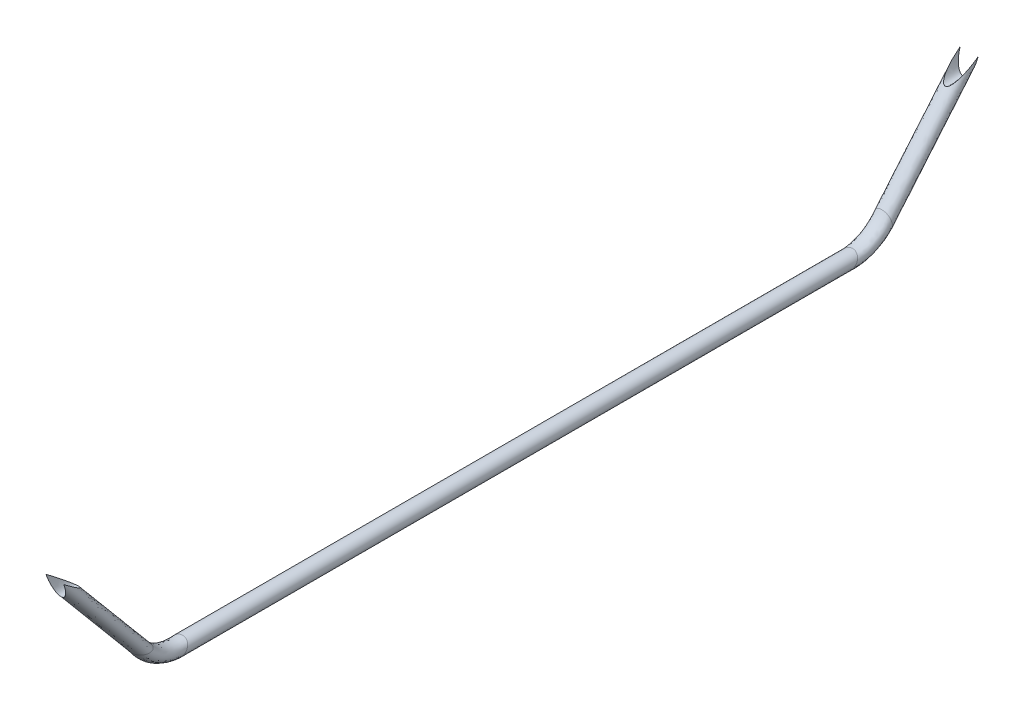
from build123d import *

# Parameters (mm, degrees)
SKETCH_2_R          = 15.000000000000004
CUT_EXTRUDE_1_DEPTH = 864.8818036412257
CUT_EXTRUDE_START   = -782.819926336
CUT_EXTRUDE_2_DEPTH = 1565.639852571


# Read off the part's stored shape, not the designer's step: Вырез-Вытянуть2
with BuildPart() as part:
    # По траектории1: sweep along a path in Эскиз1
    with BuildLine(Plane(origin=(0, 0, 0), x_dir=(0, 0, -1), z_dir=(1, 0, 0))) as sweep_1_path:
        Line((-767.8199262354576, 200), (-623.9789427971185, 28.576991225076817))
        ThreePointArc((-623.9789427971185, 28.576991225076817), (-596.504848286856, 7.4953770370679536), (-562.6953873476, 0))
        Line((-562.6953873476, 0), (562.6953873476, 0))
        ThreePointArc((562.6953873476, 0), (596.5048482868561, 7.495377037067897), (623.9789427971185, 28.576991225076817))
        Line((623.9789427971185, 28.576991225076817), (816.8152257030802, 258.39032416077043))
    # Эскиз2 → По траектории1 (sweep)
    with BuildSketch(Plane(origin=(0, 200, 0), x_dir=(1, 0, 0), z_dir=(0, 1, 0))):
        with Locations((0, -767.8199262354576)):
            Circle(SKETCH_2_R)
    sweep(path=sweep_1_path.line)

    # Эскиз4 → Вырез-Вытянуть1 (cut, through all)
    with BuildSketch(Plane.XY):
        Polygon((-15, 200), (15.000000000000005, 200), (15.000000000000005, 280), (-15.000000000000009, 280), align=None)
    extrude(amount=-CUT_EXTRUDE_1_DEPTH, mode=Mode.SUBTRACT)

    # Вырез-Вытянуть2 outline → Вырез-Вытянуть2 (cut)
    with BuildSketch(Plane.XY.offset(CUT_EXTRUDE_START)):
        with BuildLine():
            Line((15, 200), (-15, 200))
            add(Edge.make_bspline(
                [(-15, 200), (-15, 170), (-1.84e-15, 170), (14.999999999999996, 170), (15, 200)],
                knots=[1.5707963267948966, 1.5707963267948966, 1.5707963267948966, 3.141592653589793, 3.141592653589793, 4.71238898038469, 4.71238898038469, 4.71238898038469], degree=2, weights=[1, 0.7071067811865476, 1, 0.7071067811865476, 1]))
        make_face()
    extrude(amount=CUT_EXTRUDE_2_DEPTH, mode=Mode.SUBTRACT)


solid = part.part
